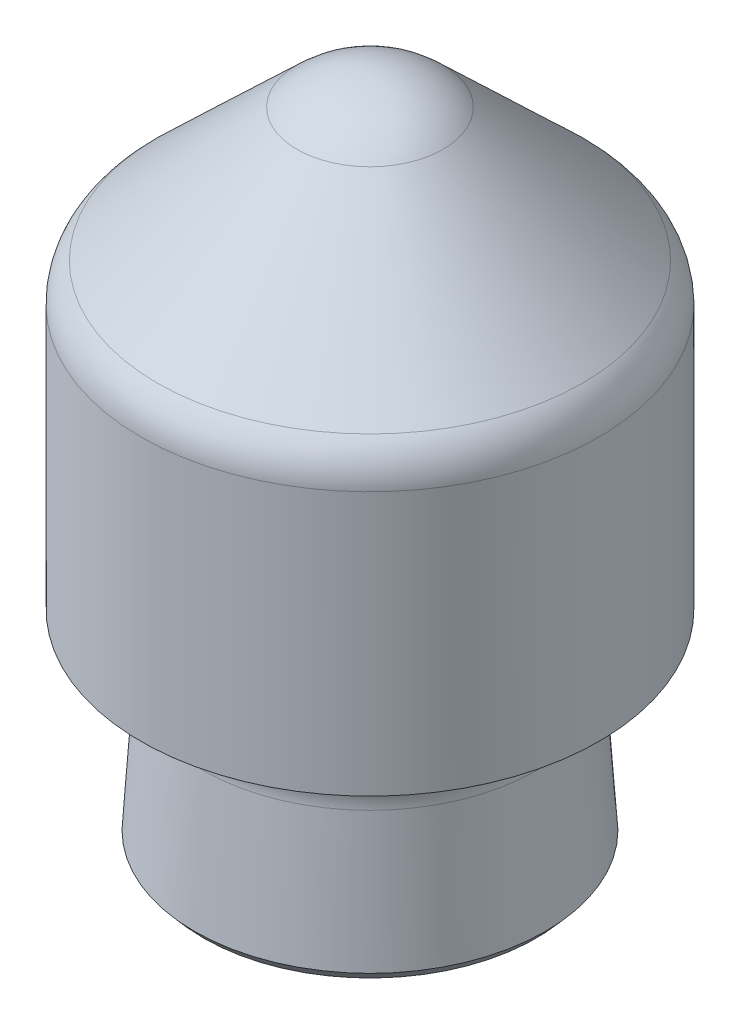
from build123d import *

# Parameters (mm, degrees)
FILLET1_R      = 1.27
FILLET2_R      = 1.27
CHAMFER1_SIZE  = 0.254
CHAMFER1_SIZE2 = 0.238876501


with BuildPart() as part:
    # Sketch1 → Revolve1 (revolve)
    with BuildSketch(Plane.XY):
        with BuildLine():
            Line((0, 25.4), (-4.2164, 25.4))
            Line((-4.2164, 25.4), (-3.899, 30.2387))
            Line((-3.899, 30.2387), (-5.4864, 30.2387))
            Line((-5.4864, 30.2387), (-5.4864, 37.0967))
            Line((-5.4864, 37.0967), (-1.750942839, 40.651254123))
            ThreePointArc((-1.750942839, 40.651254123), (-0.942831514, 41.169731055), (0, 41.3512))
            Line((0, 41.3512), (0, 25.4))
        make_face()
    revolve(axis=Axis((0, 25.4, 0), (0, 1, 0)))

    # Fillet1
    fillet1_edges = [part.edges().sort_by_distance(p)[0] for p in [
        (5.4864, 37.0967, 0),
    ]]
    fillet(fillet1_edges, radius=FILLET1_R)

    # Fillet2
    fillet2_edges = [part.edges().sort_by_distance(p)[0] for p in [
        (3.899, 30.2387, 0),
    ]]
    fillet(fillet2_edges, radius=FILLET2_R)

    # Chamfer1
    chamfer1_edges = [part.edges().sort_by_distance(p)[0] for p in [
        (4.2164, 25.4, 0),
    ]]
    chamfer1_side = [part.faces().sort_by_distance(p)[0] for p in [
        (4.102079995, 27.142785783, 0),
    ]]
    chamfer(chamfer1_edges, length=CHAMFER1_SIZE, length2=CHAMFER1_SIZE2, reference=chamfer1_side[0])


solid = part.part
